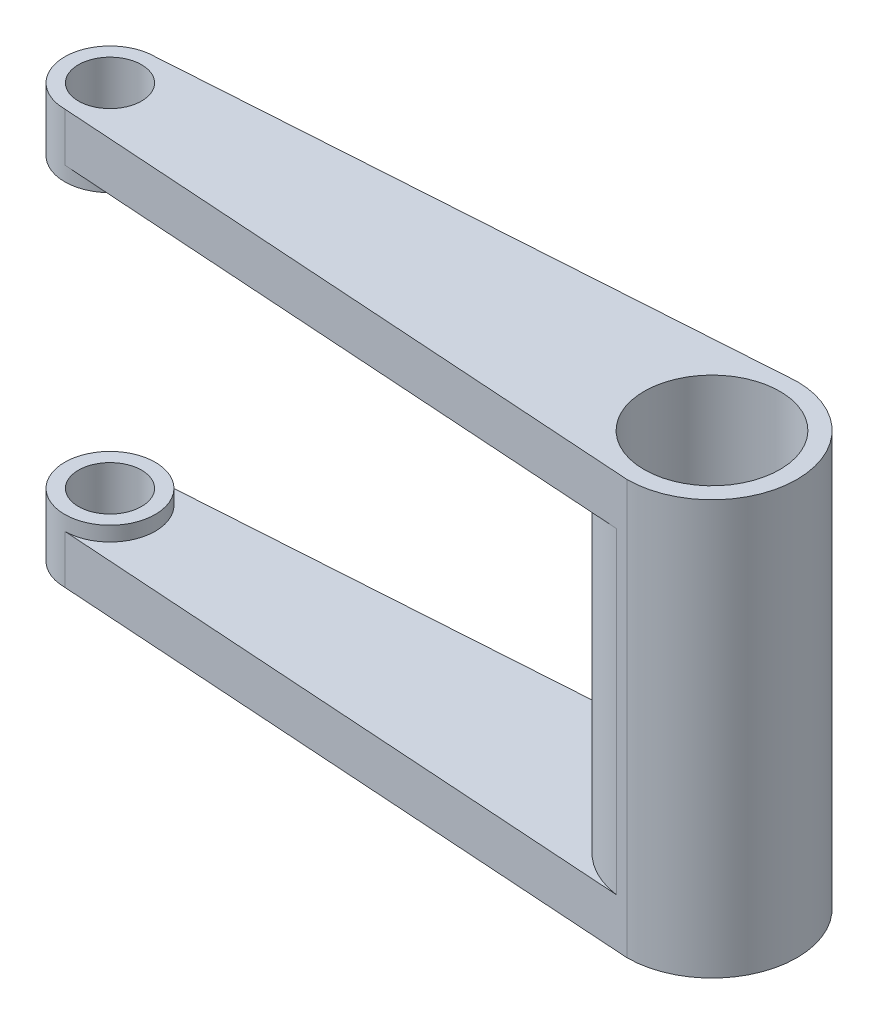
from build123d import *

# Parameters (mm, degrees)
CROQUIS11_R             = 9.320716026
CROQUIS11_R_2           = 6.498904475
SALIENTE_EXTRUIR7_DEPTH = 13
SALIENTE_EXTRUIR8_DEPTH = 10
CROQUIS11_17_R          = 13.974913408
SALIENTE_EXTRUIR9_DEPTH = 42.662603
SIMETR_A3_START         = 75.325206553
SIMETR_A3_OUTLINE_R     = 6.498904475
SIMETR_A3_OUTLINE_R_2   = 13.974913408
SIMETR_A3_DEPTH         = 10
SIMETR_A3_START_2       = 42.662603276
SIMETR_A3_2_OUTLINE_R   = 13.974913408
SIMETR_A3_2_DEPTH       = 32.662603277
SIMETR_A3_START_3       = 72.325206553
SIMETR_A3_3_OUTLINE_R   = 9.320716026
SIMETR_A3_3_OUTLINE_R_2 = 6.498904475
SIMETR_A3_3_DEPTH       = 3


# Read off the part's stored shape, not the designer's step: Simetría3
with BuildPart() as part:
    # Croquis11 → Saliente-Extruir7 (new body)
    with BuildSketch(Plane(origin=(0, 0, 0), x_dir=(1, 0, 0), z_dir=(0, 1, 0))):
        with Locations(Location((5.950503047, 0, 0), (0, 0, 90))):
            Circle(CROQUIS11_R)
        with Locations(Location((5.950503047, 0, 0), (0, 0, 90))):
            Circle(CROQUIS11_R_2, mode=Mode.SUBTRACT)
    extrude(amount=SALIENTE_EXTRUIR7_DEPTH)

    # Croquis11<13> → Saliente-Extruir8 (add)
    with BuildSketch(Plane(origin=(0, 0, 0), x_dir=(1, 0, 0), z_dir=(0, 1, 0))):
        with BuildLine():
            Line((112.450503047, 0), (15.271219073, 0))
            ThreePointArc((15.271219073, 0), (12.541244554, -6.590741507), (5.950503047, -9.320716026))
            Line((5.950503047, -9.320716026), (127.651835642, -17.348375375))
            ThreePointArc((127.651835642, -17.348375375), (116.788499408, -11.533068118), (112.450503047, 0))
        make_face()
        with BuildLine():
            ThreePointArc((5.950503047, 9.320716026), (12.541244554, 6.590741507), (15.271219073, 0))
            Line((15.271219073, 0), (112.450503047, 0))
            ThreePointArc((112.450503047, 0), (116.788499408, 11.533068118), (127.651835642, 17.348375375))
            Line((127.651835642, 17.348375375), (5.950503047, 9.320716026))
        make_face()
    extrude(amount=SALIENTE_EXTRUIR8_DEPTH)

    # Croquis11<17> → Saliente-Extruir9 (add)
    with BuildSketch(Plane(origin=(0, 0, 0), x_dir=(1, 0, 0), z_dir=(0, 1, 0))):
        with BuildLine():
            ThreePointArc((127.651835642, 17.348375375), (112.450503047, 0), (127.651835642, -17.348375375))
            Line((127.651835642, -17.348375375), (129.950503047, -17.5))
            ThreePointArc((129.950503047, -17.5), (142.324871718, -12.374368671), (147.450503047, 0))
            ThreePointArc((147.450503047, 0), (142.324871718, 12.374368671), (129.950503047, 17.5))
            Line((129.950503047, 17.5), (127.651835642, 17.348375375))
        make_face()
        with Locations(Location((129.950503047, 0, 0), (0, 0, 270))):
            Circle(CROQUIS11_17_R, mode=Mode.SUBTRACT)
    extrude(amount=SALIENTE_EXTRUIR9_DEPTH)



with BuildPart() as body_2:
    # Simetría3 outline → Simetría3 (new body)
    with BuildSketch(Plane(origin=(0, 0, 0), x_dir=(1, 0, 0), z_dir=(0, 1, 0)).offset(SIMETR_A3_START)):
        with BuildLine():
            ThreePointArc((5.950503047, 9.320716026), (-3.370212979, 0), (5.950503047, -9.320716026))
            Line((5.950503047, -9.320716026), (129.950503047, -17.5))
            ThreePointArc((129.950503047, -17.5), (147.450503047, 0), (129.950503047, 17.5))
            Line((129.950503047, 17.5), (5.950503047, 9.320716026))
        make_face()
        with Locations((5.950503047, 0)):
            Circle(SIMETR_A3_OUTLINE_R, mode=Mode.SUBTRACT)
        with Locations((129.950503047, 0)):
            Circle(SIMETR_A3_OUTLINE_R_2, mode=Mode.SUBTRACT)
    extrude(amount=SIMETR_A3_DEPTH)


with BuildPart() as part_1:
    add(part.part)

    add(body_2.part)  # Simetr_a3 2 merges body 2
    # Simetr_a3 2 outline → Simetr_a3 2 (add)
    with BuildSketch(Plane(origin=(0, 0, 0), x_dir=(1, 0, 0), z_dir=(0, 1, 0)).offset(SIMETR_A3_START_2)):
        with BuildLine():
            Line((129.950503047, 17.5), (127.651835642, 17.348375375))
            ThreePointArc((127.651835642, 17.348375375), (112.450503047, 0), (127.651835642, -17.348375375))
            Line((127.651835642, -17.348375375), (129.950503047, -17.5))
            ThreePointArc((129.950503047, -17.5), (147.450503047, 0), (129.950503047, 17.5))
        make_face()
        with Locations((129.950503047, 0)):
            Circle(SIMETR_A3_2_OUTLINE_R, mode=Mode.SUBTRACT)
    extrude(amount=SIMETR_A3_2_DEPTH)

    # Simetr_a3 3 outline → Simetr_a3 3 (add)
    with BuildSketch(Plane(origin=(0, 0, 0), x_dir=(1, 0, 0), z_dir=(0, 1, 0)).offset(SIMETR_A3_START_3)):
        with Locations((5.950503047, 0)):
            Circle(SIMETR_A3_3_OUTLINE_R)
        with Locations((5.950503047, 0)):
            Circle(SIMETR_A3_3_OUTLINE_R_2, mode=Mode.SUBTRACT)
    extrude(amount=SIMETR_A3_3_DEPTH)


solid = part_1.part
